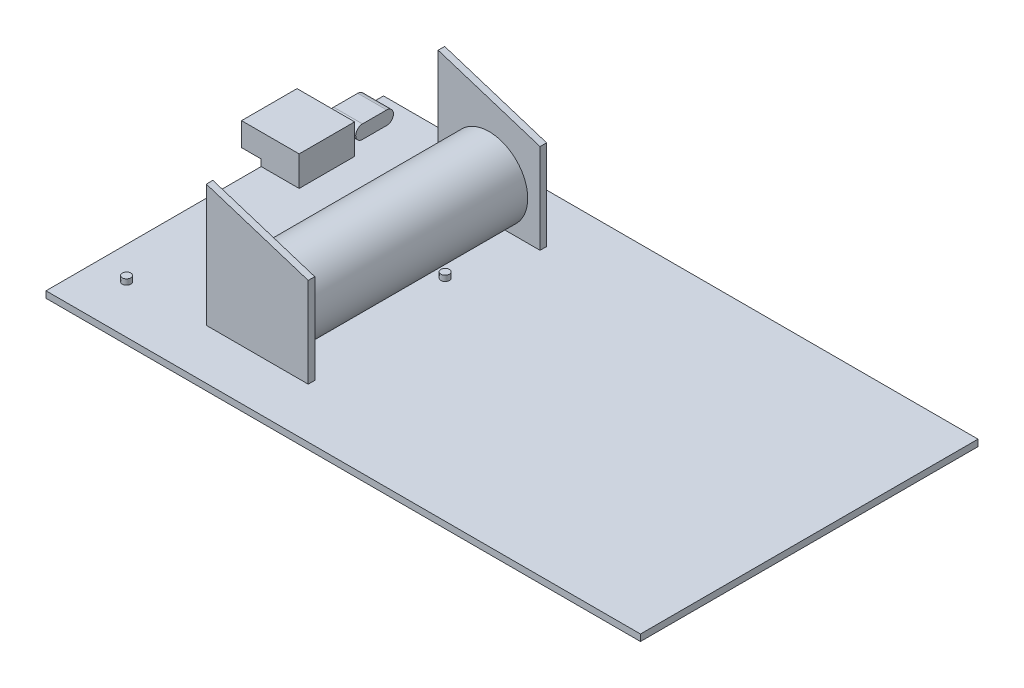
from build123d import *

# Parameters (mm, degrees)
SKETCH1_W                = 140.9
SKETCH1_H                = 80
PCB_DEPTH                = 1.55
BODYC_DEPTH              = 0.4
BODYC_DEPTH_BACK         = 6.45
BOSS_EXTRUDE4_DEPTH      = 7.1
BOSS_EXTRUDE4_DEPTH_BACK = 1.55
SKETCH4_W                = 13.65
SKETCH4_H                = 13.15
SKETCH5_W                = 4.65
SKETCH5_H                = 3.1
CUT_EXTRUDE3_DEPTH       = 14.1
SKETCH11_W               = 24.15
SKETCH11_H               = 1.55
BOSS_EXTRUDE8_DEPTH      = 29
SKETCH7_W                = 24.15
SKETCH7_H                = 1.55
BOSS_EXTRUDE5_DEPTH      = 29
CUT_EXTRUDE4_DEPTH       = 89
BATTERY_DEPTH            = 54
SKETCH13_R               = 1
BUTTON_DEPTH             = 1.3
SKETCH14_R               = 1
RESET_DEPTH              = 1.3


with BuildPart() as part:
    # Sketch1 → PCB (new body)
    with BuildSketch(Plane(origin=(0, 0, 0), x_dir=(1, 0, 0), z_dir=(0, 1, 0))):
        Rectangle(SKETCH1_W, SKETCH1_H)
    extrude(amount=PCB_DEPTH)

    # Sketch3 → bodyC (add, two sides: drawn at the far end of the back side and taken through both)
    with BuildSketch(Plane.ZY.offset(70.45).offset(-BODYC_DEPTH_BACK)):
        with BuildLine():
            Line((-34.3, 4.75), (-28.56, 4.75))
            ThreePointArc((-28.56, 4.75), (-26.96, 3.15), (-28.56, 1.55))
            Line((-28.56, 1.55), (-34.3, 1.55))
            ThreePointArc((-34.3, 1.55), (-35.9, 3.15), (-34.3, 4.75))
        make_face()
    extrude(amount=BODYC_DEPTH + BODYC_DEPTH_BACK)

    # Sketch4 → Boss-Extrude4 (add, two sides: drawn at the far end of the back side and taken through both)
    with BuildSketch(Plane(origin=(0, 1.55, 0), x_dir=(1, 0, 0), z_dir=(0, 1, 0)).offset(-BOSS_EXTRUDE4_DEPTH_BACK)):
        with Locations((-68.275, 17.575)):
            Rectangle(SKETCH4_W, SKETCH4_H)
    extrude(amount=BOSS_EXTRUDE4_DEPTH + BOSS_EXTRUDE4_DEPTH_BACK)

    # Sketch5 → Cut-Extrude3 (cut)
    with BuildSketch(Plane.XY.offset(-11)):
        with Locations((-72.775, 1.55)):
            Rectangle(SKETCH5_W, SKETCH5_H)
    extrude(amount=-CUT_EXTRUDE3_DEPTH, mode=Mode.SUBTRACT)

    # Sketch11 → Boss-Extrude8 (add)
    with BuildSketch(Plane(origin=(0, 1.55, 0), x_dir=(1, 0, 0), z_dir=(0, 1, 0))):
        with Locations((-32.275, 27.625)):
            Rectangle(SKETCH11_W, SKETCH11_H)
    extrude(amount=BOSS_EXTRUDE8_DEPTH)

    # Sketch7 → Boss-Extrude5 (add)
    with BuildSketch(Plane(origin=(0, 1.55, 0), x_dir=(1, 0, 0), z_dir=(0, 1, 0))):
        with Locations((-32.275, -27.325)):
            Rectangle(SKETCH7_W, SKETCH7_H)
    extrude(amount=BOSS_EXTRUDE5_DEPTH)

    # Sketch8 → Cut-Extrude4 (cut)
    with BuildSketch(Plane.XY.offset(28.1)):
        Polygon((-44.35, 30.55), (-20.2, 22.85), (-20.2, 30.55), align=None)
    extrude(amount=-CUT_EXTRUDE4_DEPTH, mode=Mode.SUBTRACT)

    # Sketch12 → Battery (add)
    with BuildSketch(Plane.XY.offset(-26.85)):
        with BuildLine():
            ThreePointArc((-32.275, 1.6), (-25.804972952, 4.279972952), (-23.125, 10.75))
            ThreePointArc((-23.125, 10.75), (-38.745027048, 17.220027048), (-32.275, 1.6))
        make_face()
    extrude(amount=BATTERY_DEPTH)

    # Sketch13 → Button (add)
    with BuildSketch(Plane(origin=(0, 1.55, 0), x_dir=(1, 0, 0), z_dir=(0, 1, 0))):
        with Locations((-62.75, -28.6)):
            Circle(SKETCH13_R)
    extrude(amount=BUTTON_DEPTH)

    # Sketch14 → Reset (add)
    with BuildSketch(Plane(origin=(0, 1.55, 0), x_dir=(1, 0, 0), z_dir=(0, 1, 0))):
        with Locations((-25.75, 9.9)):
            Circle(SKETCH14_R)
    extrude(amount=RESET_DEPTH)


solid = part.part
